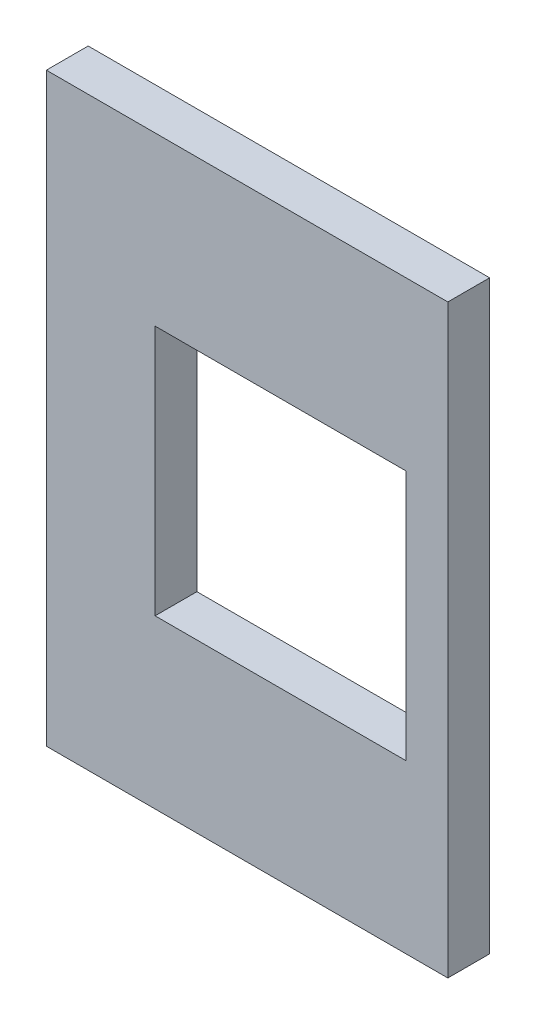
from build123d import *

# Parameters (mm, degrees)
SKETCH1_W           = 25.4
SKETCH1_H           = 44.45
SKETCH1_W_2         = 19.05
SKETCH1_H_2         = 19.05
BOSS_EXTRUDE1_DEPTH = 3.175
SKETCH4_W           = 3.175
SKETCH4_H           = 44.45
BOSS_EXTRUDE3_DEPTH = 5.08


with BuildPart() as part:
    # Sketch1 → Boss-Extrude1 (new body)
    with BuildSketch(Plane.XY):
        Rectangle(SKETCH1_W, SKETCH1_H)
        Rectangle(SKETCH1_W_2, SKETCH1_H_2, mode=Mode.SUBTRACT)
    extrude(amount=BOSS_EXTRUDE1_DEPTH)

    # Sketch4 → Boss-Extrude3 (add)
    with BuildSketch(Plane.ZY.offset(12.7)):
        with Locations((1.5875, 0)):
            Rectangle(SKETCH4_W, SKETCH4_H)
    extrude(amount=BOSS_EXTRUDE3_DEPTH)


solid = part.part
